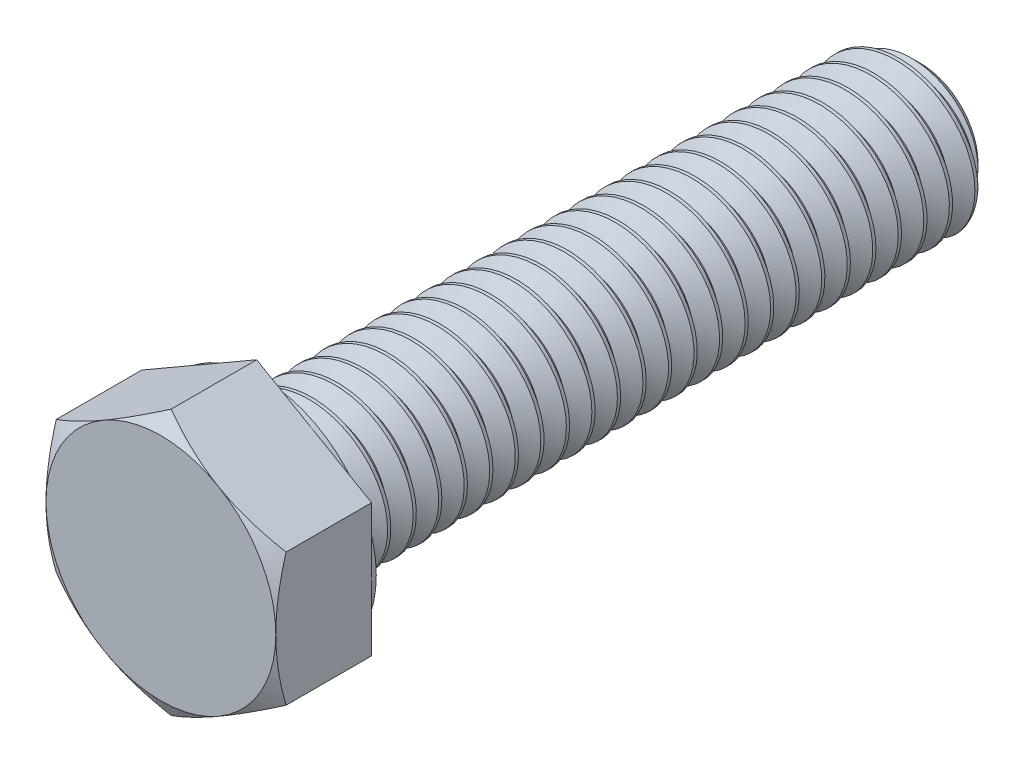
from build123d import *

# Parameters (mm, degrees)
SKETCH2_W           = 41.275
SKETCH2_H           = 4.7625
BOSS_EXTRUDE1_DEPTH = 5.953125
SKETCH7_R           = 7.08025
BOSS_EXTRUDE2_DEPTH = 0.3571875
CHAMFER1_SIZE       = 1.190625
SKETCH4_OUTSIDE_W   = 198.07
SKETCH4_OUTSIDE_H   = 200.28
SKETCH4_OUTSIDE_R   = 7.14375
CUT_EXTRUDE1_DEPTH  = 49.472395998
CUT_EXTRUDE1_DRAFT  = -60
CUT_SWEEP1_PITCH    = 1.5875
CUT_SWEEP1_TO       = 41.275
BOSS_EXTRUDE3_START = -0.3571875
SKETCH8_R           = 7.08025
BOSS_EXTRUDE3_DEPTH = 0.3571875


with BuildPart() as part:
    # Sketch2 → Revolve1 (revolve)
    with BuildSketch(Plane(origin=(0, 0, 0), x_dir=(0, 0, -1), z_dir=(1, 0, 0)), mode=Mode.PRIVATE) as revolve1_sk:
        with Locations((20.6375, 2.38125)):
            Rectangle(SKETCH2_W, SKETCH2_H)
    revolve(revolve1_sk.sketch.rotate(Axis((0, 0, 0), (0, 0, -1)), 90), axis=Axis((0, 0, 0), (0, 0, -1)))

    # Sketch3 → Boss-Extrude1 (add)
    with BuildSketch(Plane.XY):
        Polygon((0, 8.248891971), (-7.14375, 4.124445986), (-7.14375, -4.124445986), (0, -8.248891971), (7.14375, -4.124445986), (7.14375, 4.124445986), align=None)
    extrude(amount=BOSS_EXTRUDE1_DEPTH)

    # Sketch7 → Boss-Extrude2 (add)
    with BuildSketch(Plane(origin=(0, 0, 0), x_dir=(-1, 0, 0), z_dir=(0, 0, -1))):
        with Locations(Location((0, 0, 0), (0, 0, 180))):
            Circle(SKETCH7_R)
    extrude(amount=BOSS_EXTRUDE2_DEPTH)

    # Chamfer1
    chamfer1_edges = [part.edges().sort_by_distance(p)[0] for p in [
        (-4.7625, 0, -41.275),
    ]]
    chamfer(chamfer1_edges, length=CHAMFER1_SIZE)


with BuildPart() as cut_extrude1_tool:
    # Sketch4 outside → Cut-Extrude1 (with draft: the straight prism first)
    with BuildSketch(Plane.XY.offset(5.953125)):
        Rectangle(SKETCH4_OUTSIDE_W, SKETCH4_OUTSIDE_H)
        Circle(SKETCH4_OUTSIDE_R, mode=Mode.SUBTRACT)
    extrude(amount=-CUT_EXTRUDE1_DEPTH)
    # Cut-Extrude1: the draft: its side faces are tilted about the plane it starts from
    cut_extrude1_sides = [cut_extrude1_tool.faces().sort_by_distance(p)[0] for p in [
        (0, -100.14, -18.783072999),
        (99.035, 0, -18.783072999),
        (0, 100.14, -18.783072999),
        (-99.035, 0, -18.783072999),
        (-7.14375, 0, -18.783072999),
    ]]
    draft(cut_extrude1_sides, Plane.XY.offset(5.953125), CUT_EXTRUDE1_DRAFT)


with BuildPart() as part_1:
    add(part.part)

    # Cut-Extrude1: cut by cut_extrude1_tool
    add(cut_extrude1_tool.part, mode=Mode.SUBTRACT)


with BuildPart() as body_2:
    # Split1: read off the stored shape, not the designer's step
    # Split1: the piece on the far side of the plane
    add(part_1.part)
    split(bisect_by=Plane.XY, keep=Keep.BOTTOM)

    # Cut-Sweep1: arcs per turn and ends read off the stored shape
    # Cut-Sweep1: the profile of Sketch5 screwed along a right-hand helix through 27 turns, 8 arcs to a turn; built about Z, then put on its axis
    cut_sweep1_z = Axis((0, 0, 0), (0, 0, 1))
    cut_sweep1_corners = [(4.848425958, 0, 0.049609375), (4.848425958, 0, -1.438671875), (3.731388504, 0, -0.79375), (3.731388504, 0, -0.5953125)]
    with BuildLine(mode=Mode.PRIVATE) as cut_sweep1_profile:
        Line(cut_sweep1_corners[0], cut_sweep1_corners[1])
        Line(cut_sweep1_corners[1], cut_sweep1_corners[2])
        Line(cut_sweep1_corners[2], cut_sweep1_corners[3])
        Line(cut_sweep1_corners[3], cut_sweep1_corners[0])
    cut_sweep1_cap = Face(cut_sweep1_profile.wire())
    cut_sweep1_turn_angles = [0, 22.5, 45, 67.5, 90, 112.5, 135, 157.5, 180, 202.5, 225, 247.5, 270, 292.5, 315, 337.5, 360]
    cut_sweep1_turn_weights = [1, 0.9238795325112867, 1, 0.9238795325112867, 1, 0.9238795325112867, 1, 0.9238795325112867, 1, 0.9238795325112867, 1, 0.9238795325112867, 1, 0.9238795325112867, 1, 0.9238795325112867, 1]
    cut_sweep1_turn_rails = [Edge.make_bspline([Vector(p[0], p[1], 0).rotate(cut_sweep1_z, cut_sweep1_turn_angles[k]) / cut_sweep1_turn_weights[k] + Vector(0, 0, p[2] + CUT_SWEEP1_PITCH * cut_sweep1_turn_angles[k] / 360) for k in range(17)], [0, 0, 0, 1, 1, 2, 2, 3, 3, 4, 4, 5, 5, 6, 6, 7, 7, 8, 8, 8], 2, cut_sweep1_turn_weights) for p in cut_sweep1_corners]
    cut_sweep1_turn_sides = [Face.make_surface_from_curves(cut_sweep1_turn_rails[p[0]], cut_sweep1_turn_rails[p[1]]) for p in [(0, 1), (1, 2), (2, 3), (3, 0)]]
    cut_sweep1 = Plane(origin=(0, 0, -41.275), x_dir=(0, 1, 0), z_dir=(0, 0, 1)) * split(Solid(Shell([*[p.moved(Location((0, 0, CUT_SWEEP1_PITCH * i))) for i in range(27) for p in cut_sweep1_turn_sides], cut_sweep1_cap, cut_sweep1_cap.rotate(cut_sweep1_z, 9720).moved(Location((0, 0, CUT_SWEEP1_PITCH * 9720 / 360)))])), bisect_by=Plane.XY.offset(CUT_SWEEP1_TO), keep=Keep.BOTTOM, mode=Mode.PRIVATE)
    add(cut_sweep1, mode=Mode.SUBTRACT)


with BuildPart() as part_2:
    add(part_1.part)

    # Split1
    split(bisect_by=Plane.XY, keep=Keep.TOP)

    # Combine1: union body 2
    add(body_2.part)

    # Sketch8 → Boss-Extrude3 (add)
    with BuildSketch(Plane(origin=(0, 0, -0.3571875), x_dir=(-1, 0, 0), z_dir=(0, 0, -1)).offset(BOSS_EXTRUDE3_START)):
        with Locations(Location((0, 0, 0), (0, 0, 180))):
            Circle(SKETCH8_R)
    extrude(amount=BOSS_EXTRUDE3_DEPTH)


solid = part_2.part
